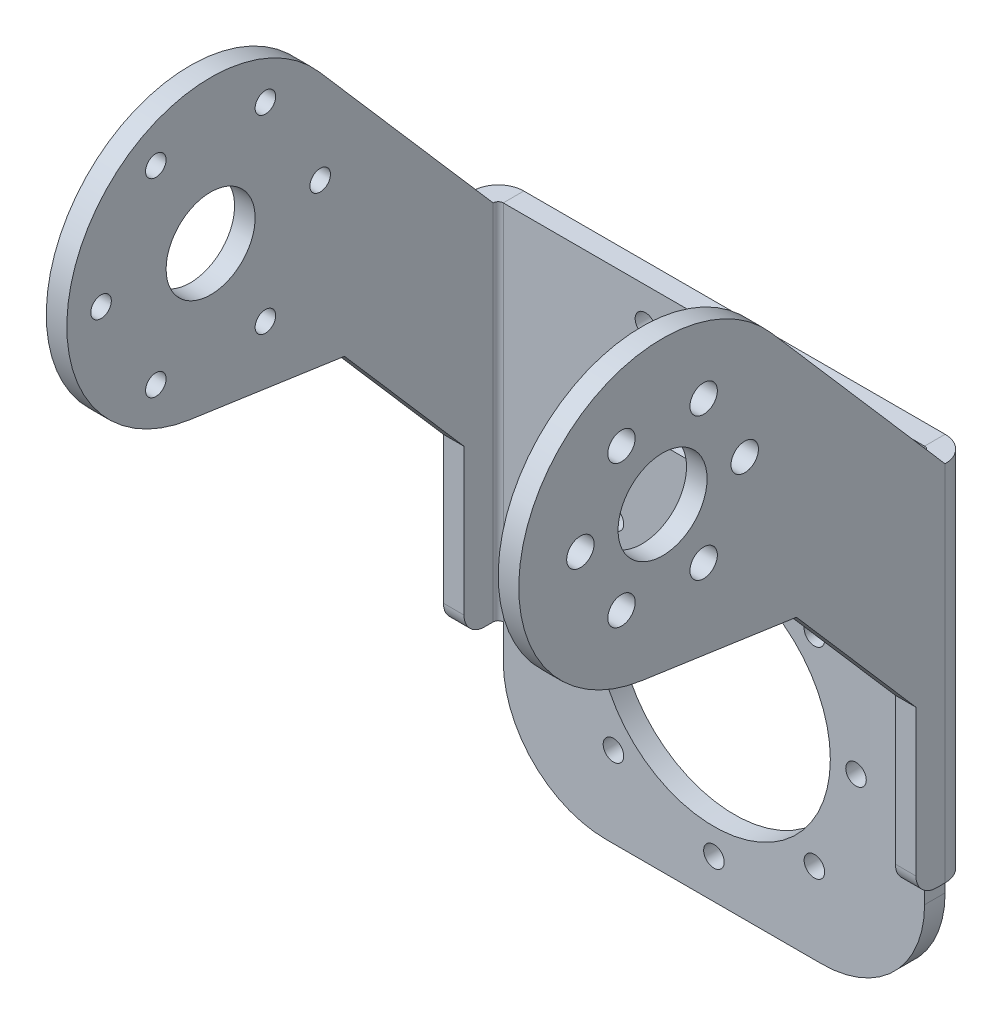
from build123d import *

# Parameters (mm, degrees)
SKETCH_1_W                         = 63
SKETCH_1_H                         = 53
SM_BASE_FLANGE_1_DEPTH             = 3
SM_EDGE_FLANGE_1_STRIP_W           = 13.4732
SM_EDGE_FLANGE_1_STRIP_H           = 3
SM_EDGE_FLANGE_1_STRIP_CUT_DEPTH   = 53
SM_EDGE_FLANGE_1_STRIP_2_W         = 13.4732
SM_EDGE_FLANGE_1_STRIP_2_H         = 3
SM_EDGE_FLANGE_1_STRIP_CUT_2_DEPTH = 53
SM_EDGE_FLANGE_1_DEPTH             = 53
SM_EDGE_FLANGE_1_BEND_DEPTH        = 53
SKETCH_16_R                        = 1.5
SKETCH_16_R_2                      = 6.5
EXTRUDE_1_DEPTH                    = 3
EXTRUDE_START                      = -3
SKETCH_21_R                        = 2
SKETCH_21_R_2                      = 6.5
EXTRUDE_5_DEPTH                    = 3
EXTRUDE_6_DEPTH                    = 3
SKETCH_23_W                        = 61.5268
SKETCH_23_H                        = 20
EXTRUDE_7_DEPTH                    = 3
SKETCH_17_R                        = 1.5
SKETCH_17_R_2                      = 17
CUT_EXTRUDE_1_DEPTH                = 98.546142927
FILLET_2_R                         = 15
FILLET_3_R                         = 3
SKETCH_24_R                        = 1.5
CUT_EXTRUDE_2_DEPTH                = 98.546142927


# Sheet-metal steps are written as plain solids
with BuildPart() as part:
    # Sketch 1 → 基体-法兰1 (new body)
    with BuildSketch(Plane.XY):
        Rectangle(SKETCH_1_W, SKETCH_1_H)
    extrude(amount=-SM_BASE_FLANGE_1_DEPTH)

    # 边线-法兰1 strip (across the edge) → 边线-法兰1 strip cut (cut)
    with BuildSketch(Plane(origin=(-31.5, 26.5, 0), x_dir=(1, 0, 0), z_dir=(0, -1, 0))):
        with Locations((-6, -1.5)):
            Rectangle(SM_EDGE_FLANGE_1_STRIP_W, SM_EDGE_FLANGE_1_STRIP_H)
    extrude(amount=SM_EDGE_FLANGE_1_STRIP_CUT_DEPTH, mode=Mode.SUBTRACT)

    # 边线-法兰1 strip 2 (across the edge) → 边线-法兰1 strip cut 2 (cut)
    with BuildSketch(Plane(origin=(31.5, -26.5, 0), x_dir=(-1, 0, 0), z_dir=(0, 1, 0))):
        with Locations((-6, -1.5)):
            Rectangle(SM_EDGE_FLANGE_1_STRIP_2_W, SM_EDGE_FLANGE_1_STRIP_2_H)
    extrude(amount=SM_EDGE_FLANGE_1_STRIP_CUT_2_DEPTH, mode=Mode.SUBTRACT)

    # 边线-法兰1 section (across the edge) → 边线-法兰1 (add)
    with BuildSketch(Plane(origin=(-31.5, 26.5, 0), x_dir=(1, 0, 0), z_dir=(0, -1, 0))):
        with BuildLine():
            Line((-3, 0.7366), (-3, 5))
            Line((-3, 5), (0, 5))
            Line((0, 5), (0, 0.7366))
            ThreePointArc((0, 0.7366), (0.215745145, 0.215745145), (0.7366, 0))
            Line((0.7366, 0), (0.7366, -3))
            ThreePointArc((0.7366, -3), (-1.905575199, -1.905575199), (-3, 0.7366))
        make_face()
    extrude(amount=SM_EDGE_FLANGE_1_DEPTH)

    # 边线-法兰1 section 2 (across the edge) → 边线-法兰1 bend (add)
    with BuildSketch(Plane(origin=(31.5, -26.5, 0), x_dir=(-1, 0, 0), z_dir=(0, 1, 0))):
        with BuildLine():
            Line((-3, 0.7366), (-3, 5))
            Line((-3, 5), (0, 5))
            Line((0, 5), (0, 0.7366))
            ThreePointArc((0, 0.7366), (0.215745145, 0.215745145), (0.7366, 0))
            Line((0.7366, 0), (0.7366, -3))
            ThreePointArc((0.7366, -3), (-1.905575199, -1.905575199), (-3, 0.7366))
        make_face()
    extrude(amount=SM_EDGE_FLANGE_1_BEND_DEPTH)

    # 草图16 → 凸台-拉伸1 (add)
    with BuildSketch(Plane.ZY.offset(34.5)):
        with BuildLine():
            Line((26.141494742, 55.766183603), (0.7366, 26.5))
            Line((0.7366, 26.5), (5, 26.5))
            Line((5, 26.5), (5, -2.149105668))
            Line((5, -2.149105668), (29.00460009, 25.503952559))
            ThreePointArc((29.00460009, 25.503952559), (62.906640519, 43.977974267), (26.141494742, 55.766183603))
        make_face()
        with Locations((50, 55.856406461)):
            Circle(SKETCH_16_R, mode=Mode.SUBTRACT)
        with Locations((26, 42)):
            Circle(SKETCH_16_R, mode=Mode.SUBTRACT)
        with Locations((34, 28.143593539)):
            Circle(SKETCH_16_R, mode=Mode.SUBTRACT)
        with Locations((50, 28.143593539)):
            Circle(SKETCH_16_R, mode=Mode.SUBTRACT)
        with Locations((42, 42)):
            Circle(SKETCH_16_R_2, mode=Mode.SUBTRACT)
        with Locations((34, 55.856406461)):
            Circle(SKETCH_16_R, mode=Mode.SUBTRACT)
        with Locations((58, 42)):
            Circle(SKETCH_16_R, mode=Mode.SUBTRACT)
    extrude(amount=-EXTRUDE_1_DEPTH)

    # 草图21 → 凸台-拉伸5 (add)
    # profile 1 of 2: a face of its own
    with BuildSketch(Plane(origin=(34.5, 0, 0), x_dir=(0, 0, -1), z_dir=(1, 0, 0)).offset(EXTRUDE_START)):
        with BuildLine():
            ThreePointArc((-26.141494742, 55.766183603), (-60.431186758, 52.06436062), (-45.007392809, 21.216458711))
            ThreePointArc((-45.007392809, 21.216458711), (-36.565322242, 21.715417735), (-29.00460009, 25.503952559))
            Line((-29.00460009, 25.503952559), (-22.449274565, 17.952283389))
            Line((-22.449274565, 17.952283389), (-5, -2.149105668))
            Line((-5, -2.149105668), (-5, 26.5))
            Line((-5, 26.5), (-0.7366, 26.5))
            Line((-0.7366, 26.5), (-26.141494742, 55.766183603))
        make_face()
        with Locations((-48, 31.607695155)):
            Circle(SKETCH_21_R, mode=Mode.SUBTRACT)
        with Locations((-36, 31.607695155)):
            Circle(SKETCH_21_R, mode=Mode.SUBTRACT)
        with Locations((-54, 42)):
            Circle(SKETCH_21_R, mode=Mode.SUBTRACT)
        with Locations((-48, 52.392304845)):
            Circle(SKETCH_21_R, mode=Mode.SUBTRACT)
        with Locations(Location((-42, 42, 0), (0, 0, 180))):
            Circle(SKETCH_21_R_2, mode=Mode.SUBTRACT)
        with Locations((-36, 52.392304845)):
            Circle(SKETCH_21_R, mode=Mode.SUBTRACT)
        with Locations((-30, 42)):
            Circle(SKETCH_21_R, mode=Mode.SUBTRACT)
    # profile 2 of 2: a face of its own
    with BuildSketch(Plane(origin=(34.5, 0, 0), x_dir=(0, 0, -1), z_dir=(1, 0, 0)).offset(EXTRUDE_START)):
        with BuildLine():
            ThreePointArc((-29.00460009, 25.503952559), (-36.565322242, 21.715417735), (-45.007392809, 21.216458711))
            Line((-45.007392809, 21.216458711), (-22.449274565, 17.952283389))
            Line((-22.449274565, 17.952283389), (-29.00460009, 25.503952559))
        make_face()
    extrude(amount=EXTRUDE_5_DEPTH)

    # 草图22 → 凸台-拉伸6 (add)
    with BuildSketch(Plane.ZY.offset(34.5)):
        with BuildLine():
            Line((22.449274565, 17.952283389), (45.007392809, 21.216458711))
            ThreePointArc((45.007392809, 21.216458711), (36.565322242, 21.715417735), (29.00460009, 25.503952559))
            Line((29.00460009, 25.503952559), (22.449274565, 17.952283389))
        make_face()
    extrude(amount=-EXTRUDE_6_DEPTH)

    # 草图23 → 凸台-拉伸7 (add)
    with BuildSketch(Plane(origin=(0, 0, -3), x_dir=(-1, 0, 0), z_dir=(0, 0, -1))):
        with Locations((0, -36.5)):
            Rectangle(SKETCH_23_W, SKETCH_23_H)
    extrude(amount=-EXTRUDE_7_DEPTH)

    # 草图17 → 切除-拉伸1 (cut, through all)
    with BuildSketch(Plane(origin=(0, 0, -3), x_dir=(-1, 0, 0), z_dir=(0, 0, -1))):
        with Locations((0, 0.75)):
            Circle(SKETCH_17_R)
        with Locations((0, -20)):
            Circle(SKETCH_17_R_2)
        with Locations((14.67246571, -5.32753429)):
            Circle(SKETCH_17_R)
        with Locations((20.75, -20)):
            Circle(SKETCH_17_R)
        with Locations((14.67246571, -34.67246571)):
            Circle(SKETCH_17_R)
        with Locations((0, -40.75)):
            Circle(SKETCH_17_R)
        with Locations((-14.67246571, -34.67246571)):
            Circle(SKETCH_17_R)
        with Locations((-20.75, -20)):
            Circle(SKETCH_17_R)
        with Locations((-14.67246571, -5.32753429)):
            Circle(SKETCH_17_R)
    extrude(amount=-CUT_EXTRUDE_1_DEPTH, mode=Mode.SUBTRACT)

    # 圆角2
    fillet_2_edges = [part.edges().sort_by_distance(p)[0] for p in [
        (-30.7634, -46.5, -1.5),
        (30.7634, -46.5, -1.5),
    ]]
    fillet(fillet_2_edges, radius=FILLET_2_R)

    # 圆角3
    fillet_3_edges = [part.edges().sort_by_distance(p)[0] for p in [
        (-33, -26.5, 5),
        (33, -26.5, 5),
    ]]
    fillet(fillet_3_edges, radius=FILLET_3_R)

    # 草图24 → 切除-拉伸2 (cut, through all)
    with BuildSketch(Plane(origin=(0, 0, -3), x_dir=(-1, 0, 0), z_dir=(0, 0, -1))):
        with Locations((10, 21.5)):
            Circle(SKETCH_24_R)
        with Locations((-10, 21.5)):
            Circle(SKETCH_24_R)
        with BuildLine():
            Line((-10, 15.5), (10, 15.5))
            ThreePointArc((10, 15.5), (14, 11.5), (10, 7.5))
            Line((10, 7.5), (-10, 7.5))
            ThreePointArc((-10, 7.5), (-14, 11.5), (-10, 15.5))
        make_face()
    extrude(amount=-CUT_EXTRUDE_2_DEPTH, mode=Mode.SUBTRACT)


solid = part.part
